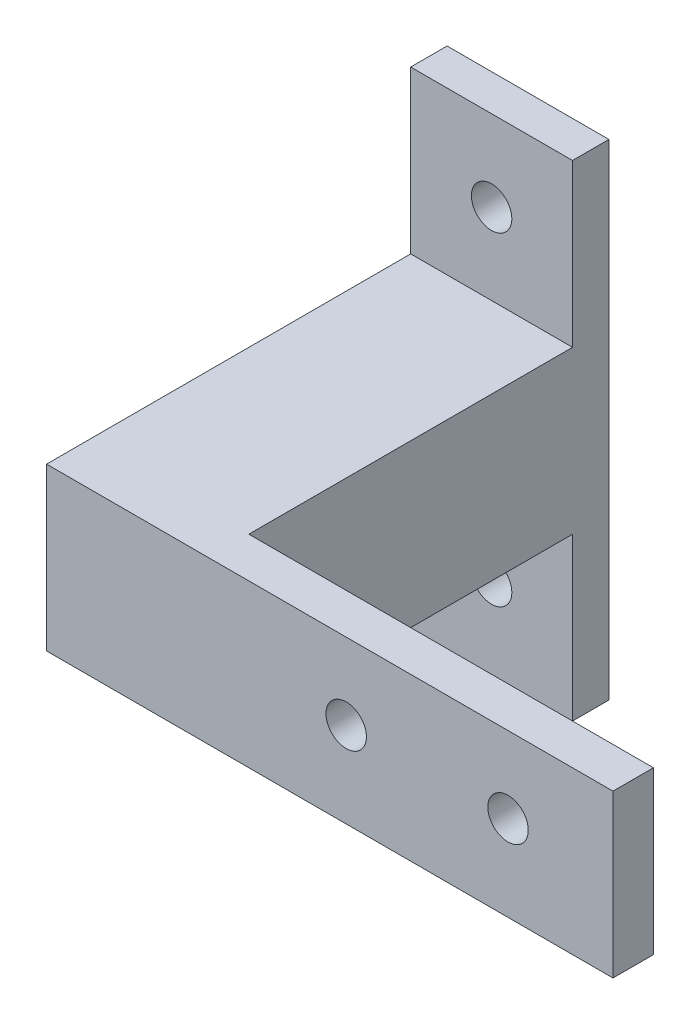
from build123d import *

# Parameters (mm, degrees)
SKETCH_1_W          = 20
SKETCH_1_H          = 60
EXTRUDE_1_DEPTH     = 4.5
SKETCH_2_W          = 20
SKETCH_2_H          = 20
EXTRUDE_2_DEPTH     = 40
SKETCH_3_W          = 70
SKETCH_3_H          = 20
EXTRUDE_3_DEPTH     = 5
SKETCH_4_R          = 2.5
CUT_EXTRUDE_1_DEPTH = 5
SKETCH_5_R          = 2.5
CUT_EXTRUDE_2_DEPTH = 5


with BuildPart() as part:
    # 草图1 → 凸台-拉伸1 (new body)
    with BuildSketch(Plane.XY):
        Rectangle(SKETCH_1_W, SKETCH_1_H)
    extrude(amount=EXTRUDE_1_DEPTH)

    # 草图2 → 凸台-拉伸2 (add)
    with BuildSketch(Plane.XY.offset(4.5)):
        Rectangle(SKETCH_2_W, SKETCH_2_H)
    extrude(amount=EXTRUDE_2_DEPTH)

    # 草图3 → 凸台-拉伸3 (add)
    with BuildSketch(Plane.XY.offset(44.5)):
        with Locations((25, 0)):
            Rectangle(SKETCH_3_W, SKETCH_3_H)
    extrude(amount=EXTRUDE_3_DEPTH)

    # 草图4 → 切除-拉伸1 (cut)
    with BuildSketch(Plane(origin=(0, 0, 44.5), x_dir=(-1, 0, 0), z_dir=(0, 0, -1))):
        with Locations((-27.029877883, 0.568886748)):
            Circle(SKETCH_4_R)
        with Locations((-47.029877883, 0.568886748)):
            Circle(SKETCH_4_R)
    extrude(amount=-CUT_EXTRUDE_1_DEPTH, mode=Mode.SUBTRACT)

    # 草图5 → 切除-拉伸2 (cut)
    with BuildSketch(Plane.XY.offset(4.5)):
        with Locations((0, 20)):
            Circle(SKETCH_5_R)
        with Locations((0, -20)):
            Circle(SKETCH_5_R)
    extrude(amount=-CUT_EXTRUDE_2_DEPTH, mode=Mode.SUBTRACT)


solid = part.part
